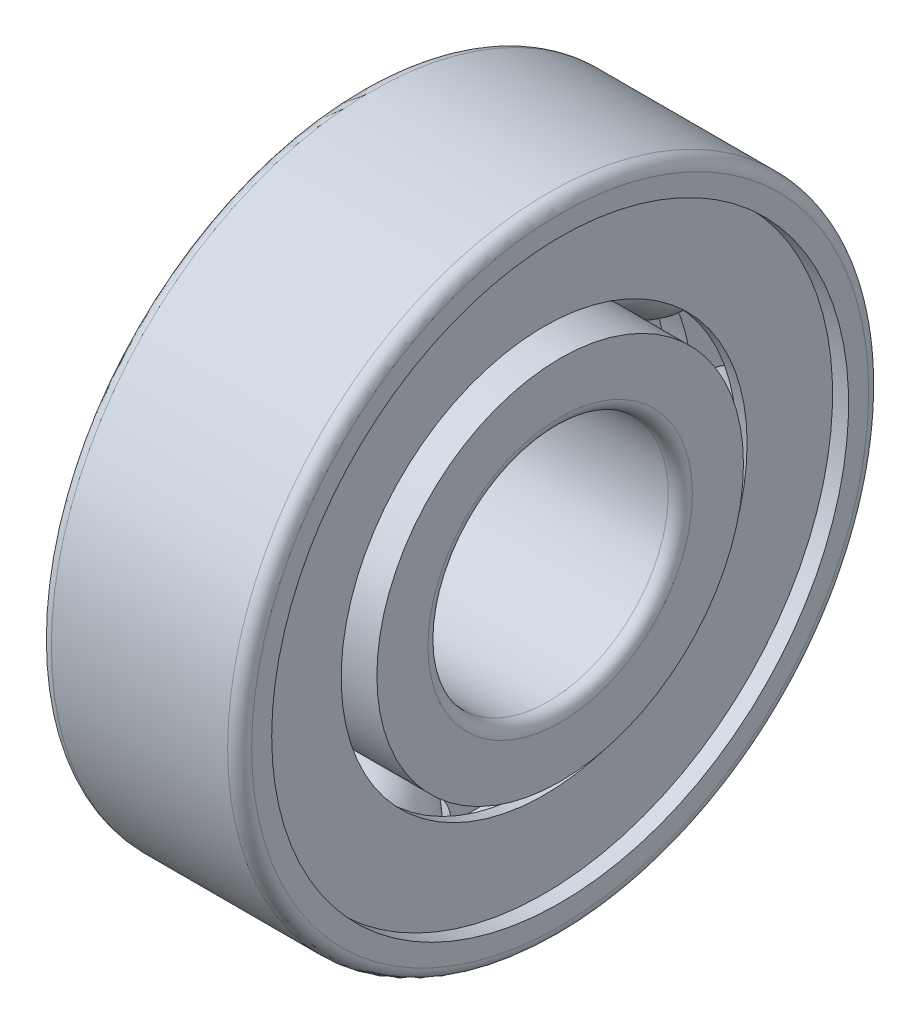
from build123d import *

# Parameters (mm, degrees)
SKETCH_2_W               = 1.30966
SKETCH_2_H               = 1.637075
PATTERN_CIRCULAR_1_COUNT = 7
SKETCH_4_W               = 6.5483
SKETCH_4_H               = 3.27415
SKETCH_5_W               = 6.5483
SKETCH_5_H               = 3.27415
PATTERN_CIRCULAR_2_COUNT = 7
SKETCH_10_W              = 0.535202389
SKETCH_10_H              = 3.867755
SKETCH_11_R              = 16
CUT_EXTRUDE_1_DEPTH      = 10


with BuildPart() as part:
    # 草图2 → Revolve 389 (revolve)
    with BuildSketch(Plane.XY):
        with Locations((0, 11.775)):
            Rectangle(SKETCH_2_W, SKETCH_2_H)
    revolve(axis=Axis((-12.420610377, 0, 0), (1, 0, 0)))

    # 草图3 → 凸台-旋转1 (revolve)
    with BuildSketch(Plane.XY):
        with BuildLine():
            Line((-3.27415, 11.775), (3.27415, 11.775))
            ThreePointArc((3.27415, 11.775), (0, 8.50085), (-3.27415, 11.775))
        make_face()
    revolve_1 = revolve(axis=Axis((-5.568093779, 11.775, 0), (1, 0, 0)))

    # 阵列(圆周)1: 凸台-旋转1 ×7 about axis
    pattern_circular_1_axis = Axis((-12.420610377, 0, 0), (1, 0, 0))
    for i in range(1, PATTERN_CIRCULAR_1_COUNT):
        add(revolve_1.rotate(pattern_circular_1_axis, i * 360 / PATTERN_CIRCULAR_1_COUNT))

    # 草图4 → 切除-旋转1 (revolve, cut)
    with BuildSketch(Plane.XY):
        with Locations((0, 14.2306125)):
            Rectangle(SKETCH_4_W, SKETCH_4_H)
    revolve(axis=Axis((0, 0, 0), (1, 0, 0)), mode=Mode.SUBTRACT)

    # 草图5 → 切除-旋转2 (revolve, cut)
    with BuildSketch(Plane.XY):
        with Locations((0, 9.3193875)):
            Rectangle(SKETCH_5_W, SKETCH_5_H)
    revolve(axis=Axis((0, 0, 0), (1, 0, 0)), mode=Mode.SUBTRACT)

    # 草图6 → 凸台-旋转2 (revolve)
    with BuildSketch(Plane.XY):
        with BuildLine():
            Line((-2.9765, 11.775), (2.9765, 11.775))
            ThreePointArc((2.9765, 11.775), (0, 8.7985), (-2.9765, 11.775))
        make_face()
    revolve_2 = revolve(axis=Axis((-5.568093779, 11.775, 0), (1, 0, 0)))

    # 阵列(圆周)2: 凸台-旋转2 ×7 about axis
    pattern_circular_2_axis = Axis((-12.420610377, 0, 0), (1, 0, 0))
    for i in range(1, PATTERN_CIRCULAR_2_COUNT):
        add(revolve_2.rotate(pattern_circular_2_axis, i * 360 / PATTERN_CIRCULAR_2_COUNT))

    # 草图7 → 凸台-旋转3 (revolve)
    with BuildSketch(Plane.XY):
        with BuildLine():
            Line((-4.4, 16), (4.4, 16))
            ThreePointArc((4.4, 16), (4.824264069, 15.824264069), (5, 15.4))
            Line((5, 15.4), (5, 14.4))
            Line((5, 14.4), (4.2, 14.4))
            Line((4.2, 14.4), (4.2, 14))
            Line((4.2, 14), (3.664797611, 14))
            Line((3.664797611, 14), (3.664797611, 14.4))
            Line((3.664797611, 14.4), (1.381845596, 14.4))
            ThreePointArc((1.381845596, 14.4), (0, 14.7415), (-1.381845596, 14.4))
            Line((-1.381845596, 14.4), (-5, 14.4))
            Line((-5, 14.4), (-5, 15.4))
            ThreePointArc((-5, 15.4), (-4.824264069, 15.824264069), (-4.4, 16))
        make_face()
    revolve(axis=Axis((0, 0, 0), (1, 0, 0)))

    # 草图8 → 凸台-旋转4 (revolve)
    with BuildSketch(Plane.XY):
        with BuildLine():
            Line((-5, 9.15), (-1.381845596, 9.15))
            ThreePointArc((-1.381845596, 9.15), (0, 8.8085), (1.381845596, 9.15))
            Line((1.381845596, 9.15), (5, 9.15))
            Line((5, 9.15), (5, 6.6))
            ThreePointArc((5, 6.6), (4.824264069, 6.175735931), (4.4, 6))
            Line((4.4, 6), (-4.4, 6))
            ThreePointArc((-4.4, 6), (-4.824264069, 6.175735931), (-5, 6.6))
            Line((-5, 6.6), (-5, 9.15))
        make_face()
    revolve(axis=Axis((-12.420610377, 0, 0), (1, 0, 0)))

    # 草图10 → 凸台-旋转5 (revolve)
    with BuildSketch(Plane.XY):
        with Locations((3.932398806, 12.0661225)):
            Rectangle(SKETCH_10_W, SKETCH_10_H)
    revolve(axis=Axis((0, 0, 0), (-1, 0, 0)))

    # 草图11 → 切除-拉伸1 (cut)
    with BuildSketch(Plane(origin=(0, 0, 0), x_dir=(0, 0, -1), z_dir=(1, 0, 0))):
        Circle(SKETCH_11_R)
    extrude(amount=-CUT_EXTRUDE_1_DEPTH, mode=Mode.SUBTRACT)

    # 镜向所有1: part across plane


with BuildPart() as part_1:
    add(part.part)
    add(part.part.mirror(Plane(origin=(0, 0, 0), x_dir=(0, 0, 1), z_dir=(1, 0, 0))))


solid = part_1.part
